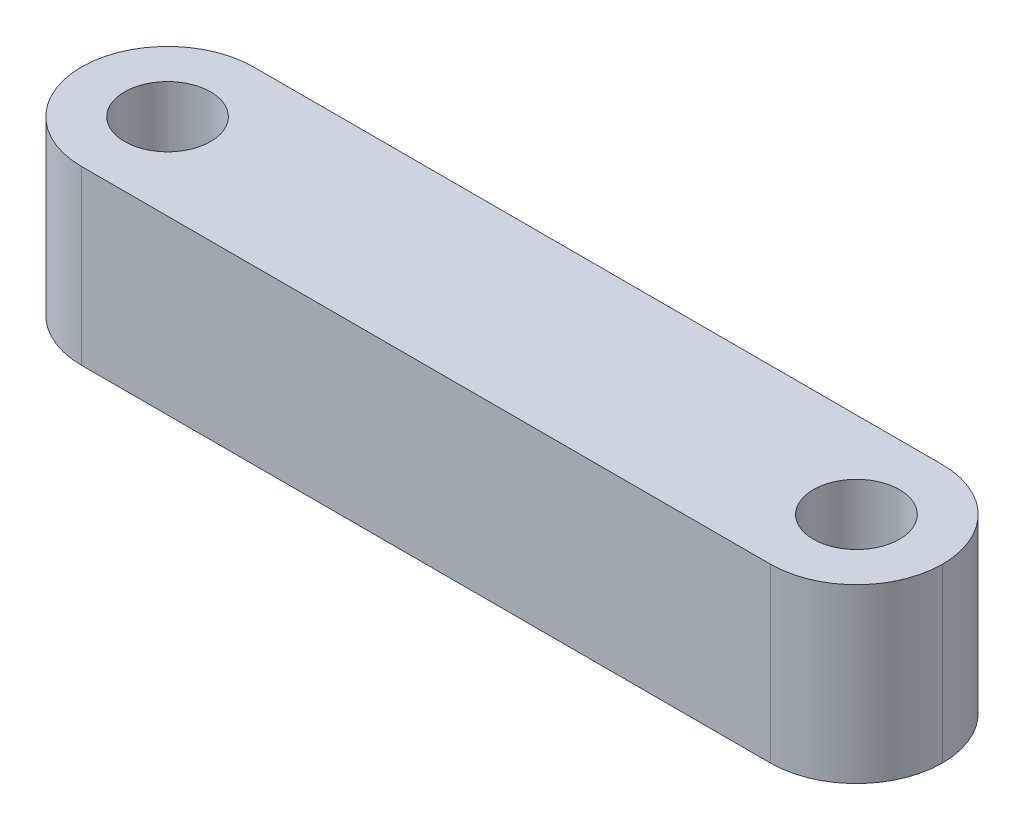
from build123d import *

# Parameters (mm, degrees)
SKETCH1_W           = 25
SKETCH1_H           = 5
BOSS_EXTRUDE1_DEPTH = 5
SKETCH2_R           = 1.25
CUT_EXTRUDE1_DEPTH  = 14.693063938
FILLET1_R           = 2.5


with BuildPart() as part:
    # Sketch1 → Boss-Extrude1 (new body)
    with BuildSketch(Plane(origin=(0, 0, 0), x_dir=(1, 0, 0), z_dir=(0, 1, 0))):
        Rectangle(SKETCH1_W, SKETCH1_H)
    extrude(amount=BOSS_EXTRUDE1_DEPTH)

    # Sketch2 → Cut-Extrude1 (cut, through all)
    with BuildSketch(Plane(origin=(0, 5, 0), x_dir=(1, 0, 0), z_dir=(0, 1, 0))):
        with Locations(Location((-10, 0, 0), (0, 0, 270))):
            Circle(SKETCH2_R)
        with Locations(Location((10, 0, 0), (0, 0, 270))):
            Circle(SKETCH2_R)
    extrude(amount=-CUT_EXTRUDE1_DEPTH, mode=Mode.SUBTRACT)

    # Fillet1
    fillet1_edges = [part.edges().sort_by_distance(p)[0] for p in [
        (12.5, 2.5, 2.5),
        (12.5, 2.5, -2.5),
        (-12.5, 2.5, 2.5),
        (-12.5, 2.5, -2.5),
    ]]
    fillet(fillet1_edges, radius=FILLET1_R - 0.0001)  # a hair under: the kernel refuses the full size


solid = part.part
